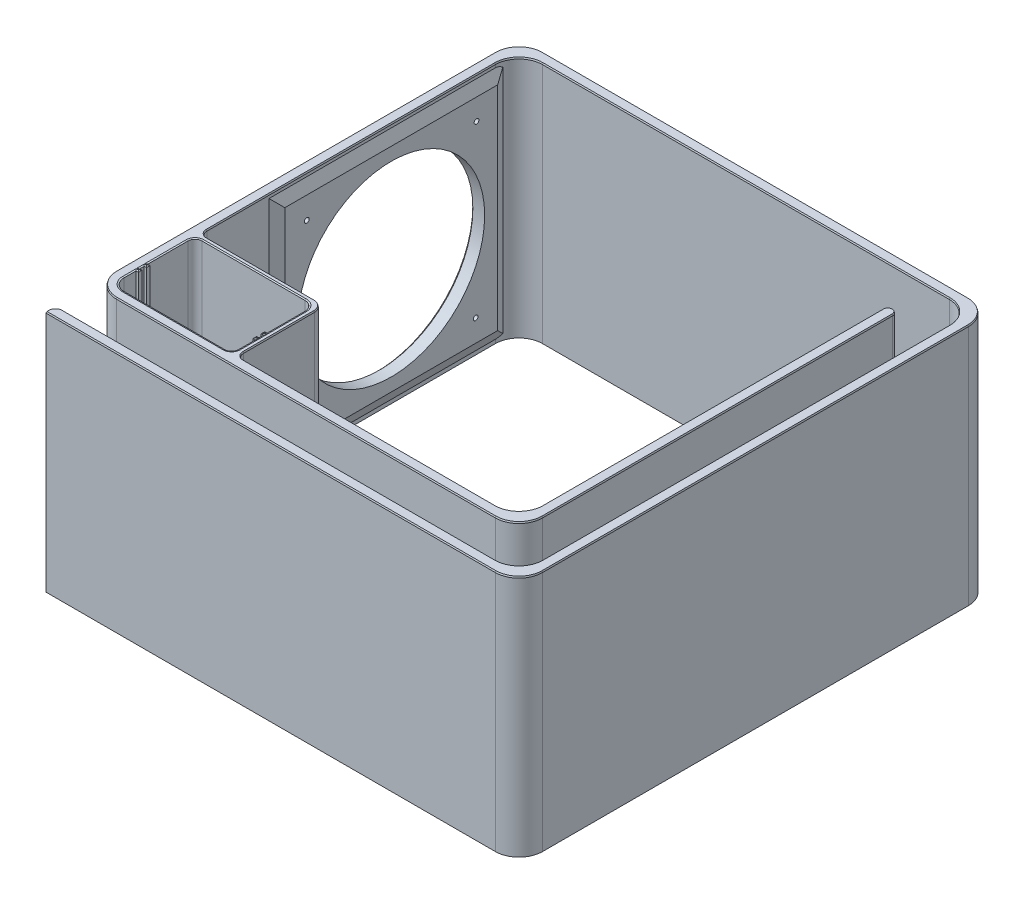
from build123d import *
from OCP.BRepFilletAPI import BRepFilletAPI_MakeChamfer

# Parameters (mm, degrees)
BOSS_EXTRUDE1_DEPTH = 103
CUT_EXTRUDE1_REACH  = 248.189
SKETCH2_R           = 39.5
SKETCH2_R_2         = 1
SKETCH3_W           = 90
SKETCH3_H           = 90
SKETCH3_R           = 39.5
BOSS_EXTRUDE2_DEPTH = 2
CUT_EXTRUDE2_REACH  = 244.951
SKETCH6_R           = 1
CHAMFER4_SIZE       = 1
CHAMFER5_SIZE       = 0.2
CHAMFER5_SIZE2      = 0.615536707
CUT_EXTRUDE3_REACH  = 248.189
FILLET1_R           = 0.4
CUT_EXTRUDE4_REACH  = 204.981


# Some blends are built 0.0001 mm under size
with BuildPart() as part:
    # Sketch1 → Boss-Extrude1 (new body)
    with BuildSketch(Plane(origin=(0, 0, 0), x_dir=(1, 0, 0), z_dir=(0, 1, 0))):
        with BuildLine():
            Line((-100, 90), (-100, -70.2))
            ThreePointArc((-100, -70.2), (-97.129646456, -77.129646456), (-90.2, -80))
            Line((-90.2, -80), (70, -80))
            ThreePointArc((70, -80), (77.071067812, -77.071067812), (80, -70))
            Line((80, -70), (80, 78))
            ThreePointArc((80, 78), (78, 80), (76, 78))
            Line((76, 78), (76, -66))
            ThreePointArc((76, -66), (73.071067812, -73.071067812), (66, -76))
            Line((66, -76), (-40.5, -76))
            ThreePointArc((-40.5, -76), (-42.621320344, -75.121320344), (-43.5, -73))
            Line((-43.5, -73), (-43.5, -43))
            ThreePointArc((-43.5, -43), (-44.671572875, -40.171572875), (-47.5, -39))
            Line((-47.5, -39), (-93, -39))
            ThreePointArc((-93, -39), (-95.121320344, -38.121320344), (-96, -36))
            Line((-96, -36), (-96, 86))
            ThreePointArc((-96, 86), (-93.071067812, 93.071067812), (-86, 96))
            Line((-86, 96), (86, 96))
            ThreePointArc((86, 96), (93.071067812, 93.071067812), (96, 86))
            Line((96, 86), (96, -86))
            ThreePointArc((96, -86), (93.071067812, -93.071067812), (86, -96))
            Line((86, -96), (-97, -96))
            ThreePointArc((-97, -96), (-99.121320344, -96.878679656), (-100, -99))
            Line((-100, -99), (-100, -100))
            Line((-100, -100), (90, -100))
            ThreePointArc((90, -100), (97.071067812, -97.071067812), (100, -90))
            Line((100, -90), (100, 90))
            ThreePointArc((100, 90), (97.071067812, 97.071067812), (90, 100))
            Line((90, 100), (-90, 100))
            ThreePointArc((-90, 100), (-97.071067812, 97.071067812), (-100, 90))
        make_face()
        with BuildLine():
            Line((-91, -76), (-48.5, -76))
            ThreePointArc((-48.5, -76), (-46.378679656, -75.121320344), (-45.5, -73))
            Line((-45.5, -73), (-45.5, -65.9))
            Line((-45.5, -65.9), (-46.5, -65.9))
            Line((-46.5, -65.9), (-46.5, -64.4))
            Line((-46.5, -64.4), (-45.5, -64.4))
            Line((-45.5, -64.4), (-45.5, -62.5))
            Line((-45.5, -62.5), (-46.5, -62.5))
            Line((-46.5, -62.5), (-46.5, -61))
            Line((-46.5, -61), (-45.5, -61))
            Line((-45.5, -61), (-45.5, -45))
            ThreePointArc((-45.5, -45), (-46.671572875, -42.171572875), (-49.5, -41))
            Line((-49.5, -41), (-93, -41))
            ThreePointArc((-93, -41), (-95.121320344, -41.878679656), (-96, -44))
            Line((-96, -44), (-96, -61))
            Line((-96, -61), (-95, -61))
            Line((-95, -61), (-95, -62.5))
            Line((-95, -62.5), (-96, -62.5))
            Line((-96, -62.5), (-96, -64.4))
            Line((-96, -64.4), (-95, -64.4))
            Line((-95, -64.4), (-95, -65.9))
            Line((-95, -65.9), (-96, -65.9))
            Line((-96, -65.9), (-96, -71))
            ThreePointArc((-96, -71), (-94.535533906, -74.535533906), (-91, -76))
        make_face(mode=Mode.SUBTRACT)
    extrude(amount=BOSS_EXTRUDE1_DEPTH)

    # Sketch2 → Cut-Extrude1 (cut, up to next)
    with BuildSketch(Plane.ZY.offset(100), mode=Mode.PRIVATE) as cut_extrude1_sk1:
        with Locations((-40, 51.5)):
            Circle(SKETCH2_R)
    cut_extrude1_tool1 = extrude(cut_extrude1_sk1.sketch, amount=-CUT_EXTRUDE1_REACH, mode=Mode.PRIVATE) & part.part
    # Sketch2 → Cut-Extrude1 (cut, up to next)
    with BuildSketch(Plane.ZY.offset(100), mode=Mode.PRIVATE) as cut_extrude1_sk2:
        with Locations((-4.29110755, 15.79110755)):
            Circle(SKETCH2_R_2)
    cut_extrude1_tool2 = extrude(cut_extrude1_sk2.sketch, amount=-CUT_EXTRUDE1_REACH, mode=Mode.PRIVATE) & part.part
    # Sketch2 → Cut-Extrude1 (cut, up to next)
    with BuildSketch(Plane.ZY.offset(100), mode=Mode.PRIVATE) as cut_extrude1_sk3:
        with Locations((-76.062445841, 87.562445841)):
            Circle(SKETCH2_R_2)
    cut_extrude1_tool3 = extrude(cut_extrude1_sk3.sketch, amount=-CUT_EXTRUDE1_REACH, mode=Mode.PRIVATE) & part.part
    # Sketch2 → Cut-Extrude1 (cut, up to next)
    with BuildSketch(Plane.ZY.offset(100), mode=Mode.PRIVATE) as cut_extrude1_sk4:
        with Locations((-4.29110755, 87.20889245)):
            Circle(SKETCH2_R_2)
    cut_extrude1_tool4 = extrude(cut_extrude1_sk4.sketch, amount=-CUT_EXTRUDE1_REACH, mode=Mode.PRIVATE) & part.part
    # Sketch2 → Cut-Extrude1 (cut, up to next)
    with BuildSketch(Plane.ZY.offset(100), mode=Mode.PRIVATE) as cut_extrude1_sk5:
        with Locations((-75.70889245, 15.79110755)):
            Circle(SKETCH2_R_2)
    cut_extrude1_tool5 = extrude(cut_extrude1_sk5.sketch, amount=-CUT_EXTRUDE1_REACH, mode=Mode.PRIVATE) & part.part
    add(cut_extrude1_tool1.solids().sort_by_distance((-100, 51.5, -40))[0], mode=Mode.SUBTRACT)
    add(cut_extrude1_tool2.solids().sort_by_distance((-100, 15.791108, -4.291108))[0], mode=Mode.SUBTRACT)
    add(cut_extrude1_tool3.solids().sort_by_distance((-100, 87.562446, -76.062446))[0], mode=Mode.SUBTRACT)
    add(cut_extrude1_tool4.solids().sort_by_distance((-100, 87.208892, -4.291108))[0], mode=Mode.SUBTRACT)
    add(cut_extrude1_tool5.solids().sort_by_distance((-100, 15.791108, -75.708892))[0], mode=Mode.SUBTRACT)

    # Sketch3 → Boss-Extrude2 (add)
    with BuildSketch(Plane(origin=(-96, 0, 0), x_dir=(0, 0, -1), z_dir=(1, 0, 0))):
        with Locations((40, 51.5)):
            Rectangle(SKETCH3_W, SKETCH3_H)
        with Locations(Location((40, 51.5, 0), (0, 0, 180))):
            Circle(SKETCH3_R, mode=Mode.SUBTRACT)
    extrude(amount=BOSS_EXTRUDE2_DEPTH)

    # Chamfer1
    # the kernel refuses this chamfer: 4.711704732, 2 mm, written as the material it adds along each edge
    with BuildSketch(Plane(origin=(-96, 6.5, 5), x_dir=(-0.015072497429862344, -0.9998864034585262, 0), z_dir=(0, 0, -1))) as chamfer1_piece_1_section:
        with BuildLine():
            Line((4.885745618, 0), (-0.204721115, -2.070789964))
            Line((-0.204721115, -2.070789964), (-0.298944505, -2.069369621))
            ThreePointArc((-0.298944505, -2.069369621), (-0.10985086, -1.035282072), (-0.09422339, 0.001420343))
            Line((-0.09422339, 0.001420343), (0.001420343, 0.09422339))
            ThreePointArc((0.001420343, 0.09422339), (2.44373818, 0.057407378), (4.887165962, 0.09422339))
            Line((4.887165962, 0.09422339), (4.885745618, 0))
        make_face()
    chamfer1_piece_1 = extrude(amount=90, mode=Mode.PRIVATE)
    chamfer1_piece_1 = split(chamfer1_piece_1, bisect_by=Plane(origin=(-94, 4.895620151, -40), z_dir=(-1, 0, 0)), keep=Keep.TOP, mode=Mode.PRIVATE)
    add(chamfer1_piece_1)
    with BuildSketch(Plane(origin=(-96, 96.5, 5), x_dir=(-0.015072497429862348, 0, 0.9998864034585262), z_dir=(0, -1, 0))) as chamfer1_piece_2_section:
        with BuildLine():
            Line((4.885745618, 0), (-0.204721115, -2.070789964))
            Line((-0.204721115, -2.070789964), (-0.298944505, -2.069369621))
            ThreePointArc((-0.298944505, -2.069369621), (-0.10985086, -1.035282072), (-0.09422339, 0.001420343))
            Line((-0.09422339, 0.001420343), (0.001420343, 0.09422339))
            ThreePointArc((0.001420343, 0.09422339), (2.44373818, 0.057407378), (4.887165962, 0.09422339))
            Line((4.887165962, 0.09422339), (4.885745618, 0))
        make_face()
    chamfer1_piece_2 = extrude(amount=90, mode=Mode.PRIVATE)
    chamfer1_piece_2 = split(chamfer1_piece_2, bisect_by=Plane(origin=(-94, 51.5, 6.604379849), z_dir=(-1, 0, 0)), keep=Keep.TOP, mode=Mode.PRIVATE)
    add(chamfer1_piece_2)
    with BuildSketch(Plane(origin=(-96, 96.5, -85), x_dir=(-0.015072497429859466, 0.9998864034585264, 0), z_dir=(0, 0, 1))) as chamfer1_piece_3_section:
        with BuildLine():
            Line((4.885745618, 0), (-0.204721115, -2.070789964))
            Line((-0.204721115, -2.070789964), (-0.298944505, -2.069369621))
            ThreePointArc((-0.298944505, -2.069369621), (-0.10985086, -1.035282072), (-0.09422339, 0.001420343))
            Line((-0.09422339, 0.001420343), (0.001420343, 0.09422339))
            ThreePointArc((0.001420343, 0.09422339), (2.44373818, 0.057407378), (4.887165962, 0.09422339))
            Line((4.887165962, 0.09422339), (4.885745618, 0))
        make_face()
    chamfer1_piece_3 = extrude(amount=90, mode=Mode.PRIVATE)
    chamfer1_piece_3 = split(chamfer1_piece_3, bisect_by=Plane(origin=(-94, 98.104379849, -40), z_dir=(-1, 0, 0)), keep=Keep.TOP, mode=Mode.PRIVATE)
    add(chamfer1_piece_3)
    with BuildSketch(Plane(origin=(-96, 6.5, -85), x_dir=(-0.015072497429859423, 0, -0.9998864034585264), z_dir=(0, 1, 0))) as chamfer1_piece_4_section:
        with BuildLine():
            Line((4.885745618, 0), (-0.204721115, -2.070789964))
            Line((-0.204721115, -2.070789964), (-0.298944505, -2.069369621))
            ThreePointArc((-0.298944505, -2.069369621), (-0.10985086, -1.035282072), (-0.09422339, 0.001420343))
            Line((-0.09422339, 0.001420343), (0.001420343, 0.09422339))
            ThreePointArc((0.001420343, 0.09422339), (2.44373818, 0.057407378), (4.887165962, 0.09422339))
            Line((4.887165962, 0.09422339), (4.885745618, 0))
        make_face()
    chamfer1_piece_4 = extrude(amount=90, mode=Mode.PRIVATE)
    chamfer1_piece_4 = split(chamfer1_piece_4, bisect_by=Plane(origin=(-94, 51.5, -86.604379849), z_dir=(-1, 0, 0)), keep=Keep.TOP, mode=Mode.PRIVATE)
    add(chamfer1_piece_4)
    with BuildSketch(Plane(origin=(-96, 96.5, 5), x_dir=(-0.015072497429862348, 0, 0.9998864034585262), z_dir=(0, -1, 0))) as chamfer1_piece_5a_section:
        with BuildLine():
            Line((4.885745618, 0), (-0.204721115, -2.070789964))
            Line((-0.204721115, -2.070789964), (-0.298944505, -2.069369621))
            ThreePointArc((-0.298944505, -2.069369621), (-0.10985086, -1.035282072), (-0.09422339, 0.001420343))
            Line((-0.09422339, 0.001420343), (0.001420343, 0.09422339))
            ThreePointArc((0.001420343, 0.09422339), (2.44373818, 0.057407378), (4.887165962, 0.09422339))
            Line((4.887165962, 0.09422339), (4.885745618, 0))
        make_face()
    chamfer1_piece_5a = extrude(amount=102.214364046, mode=Mode.PRIVATE)
    chamfer1_piece_5a = split(chamfer1_piece_5a, bisect_by=Plane(origin=(-95.378057089, 0, 6.604379849), z_dir=(0, 1, 0)), keep=Keep.TOP, mode=Mode.PRIVATE)
    chamfer1_piece_5a = split(chamfer1_piece_5a, bisect_by=Plane(origin=(-95.378057089, 6.5, 6.604379849), z_dir=(0, -1, 0)), keep=Keep.TOP, mode=Mode.PRIVATE)
    chamfer1_piece_5a = split(chamfer1_piece_5a, bisect_by=Plane(origin=(-94, 3.25, 6.604379849), z_dir=(-1, 0, 0)), keep=Keep.TOP, mode=Mode.PRIVATE)
    with BuildSketch(Plane(origin=(-96, 6.5, 17.214364046), x_dir=(-0.015072497429862344, -0.9998864034585262, 0), z_dir=(0, 0, -1))) as chamfer1_piece_5b_section:
        with BuildLine():
            Line((4.885745618, 0), (-0.204721115, -2.070789964))
            Line((-0.204721115, -2.070789964), (-0.298944505, -2.069369621))
            ThreePointArc((-0.298944505, -2.069369621), (-0.10985086, -1.035282072), (-0.09422339, 0.001420343))
            Line((-0.09422339, 0.001420343), (0.001420343, 0.09422339))
            ThreePointArc((0.001420343, 0.09422339), (2.44373818, 0.057407378), (4.887165962, 0.09422339))
            Line((4.887165962, 0.09422339), (4.885745618, 0))
        make_face()
    chamfer1_piece_5b = extrude(amount=102.214364046, mode=Mode.PRIVATE)
    chamfer1_piece_5b = split(chamfer1_piece_5b, bisect_by=Plane(origin=(-95.378057089, 4.895620151, 5), z_dir=(0, 0, 1)), keep=Keep.TOP, mode=Mode.PRIVATE)
    chamfer1_piece_5b = split(chamfer1_piece_5b, bisect_by=Plane(origin=(-94, 4.895620151, 11.107182023), z_dir=(-1, 0, 0)), keep=Keep.TOP, mode=Mode.PRIVATE)
    chamfer1_piece_5 = chamfer1_piece_5a & chamfer1_piece_5b
    add(chamfer1_piece_5)
    with BuildSketch(Plane(origin=(-96, -5.714364046, -85), x_dir=(-0.015072497429862372, 0, -0.9998864034585262), z_dir=(0, 1, 0))) as chamfer1_piece_6a_section:
        with BuildLine():
            Line((4.885745618, 0), (-0.204721115, -2.070789964))
            Line((-0.204721115, -2.070789964), (-0.298944505, -2.069369621))
            ThreePointArc((-0.298944505, -2.069369621), (-0.10985086, -1.035282072), (-0.09422339, 0.001420343))
            Line((-0.09422339, 0.001420343), (0.001420343, 0.09422339))
            ThreePointArc((0.001420343, 0.09422339), (2.44373818, 0.057407378), (4.887165962, 0.09422339))
            Line((4.887165962, 0.09422339), (4.885745618, 0))
        make_face()
    chamfer1_piece_6a = extrude(amount=102.214364046, mode=Mode.PRIVATE)
    chamfer1_piece_6a = split(chamfer1_piece_6a, bisect_by=Plane(origin=(-95.378057089, 0, -86.604379849), z_dir=(0, 1, 0)), keep=Keep.TOP, mode=Mode.PRIVATE)
    chamfer1_piece_6a = split(chamfer1_piece_6a, bisect_by=Plane(origin=(-95.378057089, 6.5, -86.604379849), z_dir=(0, -1, 0)), keep=Keep.TOP, mode=Mode.PRIVATE)
    chamfer1_piece_6a = split(chamfer1_piece_6a, bisect_by=Plane(origin=(-94, 3.25, -86.604379849), z_dir=(-1, 0, 0)), keep=Keep.TOP, mode=Mode.PRIVATE)
    with BuildSketch(Plane(origin=(-96, 6.5, 5), x_dir=(-0.015072497429862344, -0.9998864034585262, 0), z_dir=(0, 0, -1))) as chamfer1_piece_6b_section:
        with BuildLine():
            Line((4.885745618, 0), (-0.204721115, -2.070789964))
            Line((-0.204721115, -2.070789964), (-0.298944505, -2.069369621))
            ThreePointArc((-0.298944505, -2.069369621), (-0.10985086, -1.035282072), (-0.09422339, 0.001420343))
            Line((-0.09422339, 0.001420343), (0.001420343, 0.09422339))
            ThreePointArc((0.001420343, 0.09422339), (2.44373818, 0.057407378), (4.887165962, 0.09422339))
            Line((4.887165962, 0.09422339), (4.885745618, 0))
        make_face()
    chamfer1_piece_6b = extrude(amount=102.214364046, mode=Mode.PRIVATE)
    chamfer1_piece_6b = split(chamfer1_piece_6b, bisect_by=Plane(origin=(-95.378057089, 4.895620151, -85), z_dir=(0, 0, -1)), keep=Keep.TOP, mode=Mode.PRIVATE)
    chamfer1_piece_6b = split(chamfer1_piece_6b, bisect_by=Plane(origin=(-94, 4.895620151, -91.107182023), z_dir=(-1, 0, 0)), keep=Keep.TOP, mode=Mode.PRIVATE)
    chamfer1_piece_6 = chamfer1_piece_6a & chamfer1_piece_6b
    add(chamfer1_piece_6)
    with BuildSketch(Plane(origin=(-96, 108.714364046, 5), x_dir=(-0.015072497429862344, 0, 0.9998864034585262), z_dir=(0, -1, 0))) as chamfer1_piece_7a_section:
        with BuildLine():
            Line((4.885745618, 0), (-0.204721115, -2.070789964))
            Line((-0.204721115, -2.070789964), (-0.298944505, -2.069369621))
            ThreePointArc((-0.298944505, -2.069369621), (-0.10985086, -1.035282072), (-0.09422339, 0.001420343))
            Line((-0.09422339, 0.001420343), (0.001420343, 0.09422339))
            ThreePointArc((0.001420343, 0.09422339), (2.44373818, 0.057407378), (4.887165962, 0.09422339))
            Line((4.887165962, 0.09422339), (4.885745618, 0))
        make_face()
    chamfer1_piece_7a = extrude(amount=102.214364046, mode=Mode.PRIVATE)
    chamfer1_piece_7a = split(chamfer1_piece_7a, bisect_by=Plane(origin=(-95.378057089, 103, 6.604379849), z_dir=(0, -1, 0)), keep=Keep.TOP, mode=Mode.PRIVATE)
    chamfer1_piece_7a = split(chamfer1_piece_7a, bisect_by=Plane(origin=(-95.378057089, 96.5, 6.604379849), z_dir=(0, 1, 0)), keep=Keep.TOP, mode=Mode.PRIVATE)
    chamfer1_piece_7a = split(chamfer1_piece_7a, bisect_by=Plane(origin=(-94, 99.75, 6.604379849), z_dir=(-1, 0, 0)), keep=Keep.TOP, mode=Mode.PRIVATE)
    with BuildSketch(Plane(origin=(-96, 96.5, -85), x_dir=(-0.015072497429859466, 0.9998864034585264, 0), z_dir=(0, 0, 1))) as chamfer1_piece_7b_section:
        with BuildLine():
            Line((4.885745618, 0), (-0.204721115, -2.070789964))
            Line((-0.204721115, -2.070789964), (-0.298944505, -2.069369621))
            ThreePointArc((-0.298944505, -2.069369621), (-0.10985086, -1.035282072), (-0.09422339, 0.001420343))
            Line((-0.09422339, 0.001420343), (0.001420343, 0.09422339))
            ThreePointArc((0.001420343, 0.09422339), (2.44373818, 0.057407378), (4.887165962, 0.09422339))
            Line((4.887165962, 0.09422339), (4.885745618, 0))
        make_face()
    chamfer1_piece_7b = extrude(amount=102.214364046, mode=Mode.PRIVATE)
    chamfer1_piece_7b = split(chamfer1_piece_7b, bisect_by=Plane(origin=(-95.378057089, 98.104379849, 5), z_dir=(0, 0, 1)), keep=Keep.TOP, mode=Mode.PRIVATE)
    chamfer1_piece_7b = split(chamfer1_piece_7b, bisect_by=Plane(origin=(-94, 98.104379849, 11.107182023), z_dir=(-1, 0, 0)), keep=Keep.TOP, mode=Mode.PRIVATE)
    chamfer1_piece_7 = chamfer1_piece_7a & chamfer1_piece_7b
    add(chamfer1_piece_7)
    with BuildSketch(Plane(origin=(-96, 96.5, -97.214364046), x_dir=(-0.015072497429862372, 0.9998864034585262, 0), z_dir=(0, 0, 1))) as chamfer1_piece_8a_section:
        with BuildLine():
            Line((4.885745618, 0), (-0.204721115, -2.070789964))
            Line((-0.204721115, -2.070789964), (-0.298944505, -2.069369621))
            ThreePointArc((-0.298944505, -2.069369621), (-0.10985086, -1.035282072), (-0.09422339, 0.001420343))
            Line((-0.09422339, 0.001420343), (0.001420343, 0.09422339))
            ThreePointArc((0.001420343, 0.09422339), (2.44373818, 0.057407378), (4.887165962, 0.09422339))
            Line((4.887165962, 0.09422339), (4.885745618, 0))
        make_face()
    chamfer1_piece_8a = extrude(amount=102.214364046, mode=Mode.PRIVATE)
    chamfer1_piece_8a = split(chamfer1_piece_8a, bisect_by=Plane(origin=(-95.378057089, 98.104379849, -85), z_dir=(0, 0, -1)), keep=Keep.TOP, mode=Mode.PRIVATE)
    chamfer1_piece_8a = split(chamfer1_piece_8a, bisect_by=Plane(origin=(-94, 98.104379849, -91.107182023), z_dir=(-1, 0, 0)), keep=Keep.TOP, mode=Mode.PRIVATE)
    with BuildSketch(Plane(origin=(-96, 6.5, -85), x_dir=(-0.015072497429859423, 0, -0.9998864034585264), z_dir=(0, 1, 0))) as chamfer1_piece_8b_section:
        with BuildLine():
            Line((4.885745618, 0), (-0.204721115, -2.070789964))
            Line((-0.204721115, -2.070789964), (-0.298944505, -2.069369621))
            ThreePointArc((-0.298944505, -2.069369621), (-0.10985086, -1.035282072), (-0.09422339, 0.001420343))
            Line((-0.09422339, 0.001420343), (0.001420343, 0.09422339))
            ThreePointArc((0.001420343, 0.09422339), (2.44373818, 0.057407378), (4.887165962, 0.09422339))
            Line((4.887165962, 0.09422339), (4.885745618, 0))
        make_face()
    chamfer1_piece_8b = extrude(amount=102.214364046, mode=Mode.PRIVATE)
    chamfer1_piece_8b = split(chamfer1_piece_8b, bisect_by=Plane(origin=(-95.378057089, 103, -86.604379849), z_dir=(0, -1, 0)), keep=Keep.TOP, mode=Mode.PRIVATE)
    chamfer1_piece_8b = split(chamfer1_piece_8b, bisect_by=Plane(origin=(-95.378057089, 96.5, -86.604379849), z_dir=(0, 1, 0)), keep=Keep.TOP, mode=Mode.PRIVATE)
    chamfer1_piece_8b = split(chamfer1_piece_8b, bisect_by=Plane(origin=(-94, 99.75, -86.604379849), z_dir=(-1, 0, 0)), keep=Keep.TOP, mode=Mode.PRIVATE)
    chamfer1_piece_8 = chamfer1_piece_8a & chamfer1_piece_8b
    add(chamfer1_piece_8)

    # Sketch6 → Cut-Extrude2 (cut, up to next)
    with BuildSketch(Plane.ZY.offset(96), mode=Mode.PRIVATE) as cut_extrude2_sk1:
        with Locations((-75.70889245, 15.79110755)):
            Circle(SKETCH6_R)
    cut_extrude2_tool1 = extrude(cut_extrude2_sk1.sketch, amount=-CUT_EXTRUDE2_REACH, mode=Mode.PRIVATE) & part.part
    # Sketch6 → Cut-Extrude2 (cut, up to next)
    with BuildSketch(Plane.ZY.offset(96), mode=Mode.PRIVATE) as cut_extrude2_sk2:
        with Locations((-4.29110755, 15.79110755)):
            Circle(SKETCH6_R)
    cut_extrude2_tool2 = extrude(cut_extrude2_sk2.sketch, amount=-CUT_EXTRUDE2_REACH, mode=Mode.PRIVATE) & part.part
    # Sketch6 → Cut-Extrude2 (cut, up to next)
    with BuildSketch(Plane.ZY.offset(96), mode=Mode.PRIVATE) as cut_extrude2_sk3:
        with Locations((-76.062445841, 87.562445841)):
            Circle(SKETCH6_R)
    cut_extrude2_tool3 = extrude(cut_extrude2_sk3.sketch, amount=-CUT_EXTRUDE2_REACH, mode=Mode.PRIVATE) & part.part
    # Sketch6 → Cut-Extrude2 (cut, up to next)
    with BuildSketch(Plane.ZY.offset(96), mode=Mode.PRIVATE) as cut_extrude2_sk4:
        with Locations((-4.29110755, 87.20889245)):
            Circle(SKETCH6_R)
    cut_extrude2_tool4 = extrude(cut_extrude2_sk4.sketch, amount=-CUT_EXTRUDE2_REACH, mode=Mode.PRIVATE) & part.part
    add(cut_extrude2_tool1.solids().sort_by_distance((-96, 15.791108, -75.708892))[0], mode=Mode.SUBTRACT)
    add(cut_extrude2_tool2.solids().sort_by_distance((-96, 15.791108, -4.291108))[0], mode=Mode.SUBTRACT)
    add(cut_extrude2_tool3.solids().sort_by_distance((-96, 87.562446, -76.062446))[0], mode=Mode.SUBTRACT)
    add(cut_extrude2_tool4.solids().sort_by_distance((-96, 87.208892, -4.291108))[0], mode=Mode.SUBTRACT)

    # Chamfer4
    chamfer4_edges = [part.edges().sort_by_distance(p)[0] for p in [
        (-100, 51.5, -79.5),
    ]]
    chamfer(chamfer4_edges, length=CHAMFER4_SIZE)

    # Chamfer5: one chamfer whose edges measure the first distance from different faces: ONE call of the kernel's chamfer builder (chamfer() names one face for all edges)
    chamfer5_edges_1 = [part.edges().sort_by_distance(p)[0] for p in [
        (-46, 103, 64.4),
    ]]
    chamfer5_side_1 = [part.faces().sort_by_distance(p)[0] for p in [
        (-46, 51.5, 64.4),
    ]]
    chamfer5_edges_2 = [part.edges().sort_by_distance(p)[0] for p in [
        (-45.5, 103, 63.45),
    ]]
    chamfer5_side_2 = [part.faces().sort_by_distance(p)[0] for p in [
        (-45.5, 51.5, 63.45),
    ]]
    chamfer5_edges_3 = [part.edges().sort_by_distance(p)[0] for p in [
        (-46, 103, 62.5),
    ]]
    chamfer5_side_3 = [part.faces().sort_by_distance(p)[0] for p in [
        (-46, 51.5, 62.5),
    ]]
    chamfer5_edges_4 = [part.edges().sort_by_distance(p)[0] for p in [
        (-100, 103, -9.9),
        (-97.129646456, 103, 77.129646456),
        (-10.1, 103, 80),
        (77.071067812, 103, 77.071067812),
        (80, 103, -4),
        (73.071067812, 103, 73.071067812),
        (12.75, 103, 76),
        (-42.621320344, 103, 75.121320344),
        (-43.5, 103, 58),
        (-44.671572875, 103, 40.171572875),
        (-70.25, 103, 39),
        (-95.121320344, 103, 38.121320344),
        (-96, 103, -25),
        (-93.071067812, 103, -93.071067812),
        (0, 103, -96),
        (78, 103, -80),
        (93.071067812, 103, -93.071067812),
        (96, 103, 0),
        (93.071067812, 103, 93.071067812),
        (-5.5, 103, 96),
        (-99.121320344, 103, 96.878679656),
        (-100, 103, 99.5),
        (-5, 103, 100),
        (97.071067812, 103, 97.071067812),
        (100, 103, 0),
        (97.071067812, 103, -97.071067812),
        (76, 103, -6),
        (0, 103, -100),
        (-97.071067812, 103, -97.071067812),
    ]]
    chamfer5_side_4 = [part.faces().sort_by_distance(p)[0] for p in [
        (95.071067812, 103, 95.071067812),
    ]]
    chamfer5_edges_5 = [part.edges().sort_by_distance(p)[0] for p in [
        (-46.5, 103, 61.75),
    ]]
    chamfer5_side_5 = [part.faces().sort_by_distance(p)[0] for p in [
        (-46.5, 51.5, 61.75),
    ]]
    chamfer5_edges_6 = [part.edges().sort_by_distance(p)[0] for p in [
        (-46, 103, 61),
    ]]
    chamfer5_side_6 = [part.faces().sort_by_distance(p)[0] for p in [
        (-46, 51.5, 61),
    ]]
    chamfer5_edges_7 = [part.edges().sort_by_distance(p)[0] for p in [
        (-45.5, 103, 53),
    ]]
    chamfer5_side_7 = [part.faces().sort_by_distance(p)[0] for p in [
        (-45.5, 51.5, 53),
    ]]
    chamfer5_edges_8 = [part.edges().sort_by_distance(p)[0] for p in [
        (-46.671572875, 103, 42.171572875),
    ]]
    chamfer5_side_8 = [part.faces().sort_by_distance(p)[0] for p in [
        (-46.671572875, 51.5, 42.171572875),
    ]]
    chamfer5_edges_9 = [part.edges().sort_by_distance(p)[0] for p in [
        (-71.25, 103, 41),
    ]]
    chamfer5_side_9 = [part.faces().sort_by_distance(p)[0] for p in [
        (-71.25, 51.5, 41),
    ]]
    chamfer5_edges_10 = [part.edges().sort_by_distance(p)[0] for p in [
        (-95.121320344, 103, 41.878679656),
    ]]
    chamfer5_side_10 = [part.faces().sort_by_distance(p)[0] for p in [
        (-95.121320344, 51.5, 41.878679656),
    ]]
    chamfer5_edges_11 = [part.edges().sort_by_distance(p)[0] for p in [
        (-96, 103, 52.5),
    ]]
    chamfer5_side_11 = [part.faces().sort_by_distance(p)[0] for p in [
        (-96, 51.5, 52.5),
    ]]
    chamfer5_edges_12 = [part.edges().sort_by_distance(p)[0] for p in [
        (-95.5, 103, 61),
    ]]
    chamfer5_side_12 = [part.faces().sort_by_distance(p)[0] for p in [
        (-95.5, 51.5, 61),
    ]]
    chamfer5_edges_13 = [part.edges().sort_by_distance(p)[0] for p in [
        (-95, 103, 61.75),
    ]]
    chamfer5_side_13 = [part.faces().sort_by_distance(p)[0] for p in [
        (-95, 51.5, 61.75),
    ]]
    chamfer5_edges_14 = [part.edges().sort_by_distance(p)[0] for p in [
        (-95.5, 103, 62.5),
    ]]
    chamfer5_side_14 = [part.faces().sort_by_distance(p)[0] for p in [
        (-95.5, 51.5, 62.5),
    ]]
    chamfer5_edges_15 = [part.edges().sort_by_distance(p)[0] for p in [
        (-96, 103, 63.45),
    ]]
    chamfer5_side_15 = [part.faces().sort_by_distance(p)[0] for p in [
        (-96, 51.5, 63.45),
    ]]
    chamfer5_edges_16 = [part.edges().sort_by_distance(p)[0] for p in [
        (-95.5, 103, 64.4),
    ]]
    chamfer5_side_16 = [part.faces().sort_by_distance(p)[0] for p in [
        (-95.5, 51.5, 64.4),
    ]]
    chamfer5_edges_17 = [part.edges().sort_by_distance(p)[0] for p in [
        (-95, 103, 65.15),
    ]]
    chamfer5_side_17 = [part.faces().sort_by_distance(p)[0] for p in [
        (-95, 51.5, 65.15),
    ]]
    chamfer5_edges_18 = [part.edges().sort_by_distance(p)[0] for p in [
        (-95.5, 103, 65.9),
    ]]
    chamfer5_side_18 = [part.faces().sort_by_distance(p)[0] for p in [
        (-95.5, 51.5, 65.9),
    ]]
    chamfer5_edges_19 = [part.edges().sort_by_distance(p)[0] for p in [
        (-96, 103, 68.45),
    ]]
    chamfer5_side_19 = [part.faces().sort_by_distance(p)[0] for p in [
        (-96, 51.5, 68.45),
    ]]
    chamfer5_edges_20 = [part.edges().sort_by_distance(p)[0] for p in [
        (80, 0, -4),
    ]]
    chamfer5_side_20 = [part.faces().sort_by_distance(p)[0] for p in [
        (80, 51.5, -4),
    ]]
    chamfer5_edges_21 = [part.edges().sort_by_distance(p)[0] for p in [
        (77.071067812, 0, 77.071067812),
    ]]
    chamfer5_side_21 = [part.faces().sort_by_distance(p)[0] for p in [
        (77.071067812, 51.5, 77.071067812),
    ]]
    chamfer5_edges_22 = [part.edges().sort_by_distance(p)[0] for p in [
        (-10.1, 0, 80),
    ]]
    chamfer5_side_22 = [part.faces().sort_by_distance(p)[0] for p in [
        (-10.1, 51.5, 80),
    ]]
    chamfer5_edges_23 = [part.edges().sort_by_distance(p)[0] for p in [
        (-97.129646456, 0, 77.129646456),
    ]]
    chamfer5_side_23 = [part.faces().sort_by_distance(p)[0] for p in [
        (-97.129646456, 51.5, 77.129646456),
    ]]
    chamfer5_edges_24 = [part.edges().sort_by_distance(p)[0] for p in [
        (-100, 0, -9.9),
    ]]
    chamfer5_side_24 = [part.faces().sort_by_distance(p)[0] for p in [
        (-100, 51.49990201, 3.817166393),
    ]]
    chamfer5_edges_25 = [part.edges().sort_by_distance(p)[0] for p in [
        (-97.071067812, 0, -97.071067812),
    ]]
    chamfer5_side_25 = [part.faces().sort_by_distance(p)[0] for p in [
        (-97.071067812, 51.5, -97.071067812),
    ]]
    chamfer5_edges_26 = [part.edges().sort_by_distance(p)[0] for p in [
        (0, 0, -100),
    ]]
    chamfer5_side_26 = [part.faces().sort_by_distance(p)[0] for p in [
        (0, 51.5, -100),
    ]]
    chamfer5_edges_27 = [part.edges().sort_by_distance(p)[0] for p in [
        (97.071067812, 0, -97.071067812),
    ]]
    chamfer5_side_27 = [part.faces().sort_by_distance(p)[0] for p in [
        (97.071067812, 51.5, -97.071067812),
    ]]
    chamfer5_edges_28 = [part.edges().sort_by_distance(p)[0] for p in [
        (100, 0, 0),
    ]]
    chamfer5_side_28 = [part.faces().sort_by_distance(p)[0] for p in [
        (100, 51.5, 0),
    ]]
    chamfer5_edges_29 = [part.edges().sort_by_distance(p)[0] for p in [
        (97.071067812, 0, 97.071067812),
    ]]
    chamfer5_side_29 = [part.faces().sort_by_distance(p)[0] for p in [
        (97.071067812, 51.5, 97.071067812),
    ]]
    chamfer5_edges_30 = [part.edges().sort_by_distance(p)[0] for p in [
        (-5, 0, 100),
    ]]
    chamfer5_side_30 = [part.faces().sort_by_distance(p)[0] for p in [
        (-5, 51.5, 100),
    ]]
    chamfer5_edges_31 = [part.edges().sort_by_distance(p)[0] for p in [
        (-100, 0, 99.5),
    ]]
    chamfer5_side_31 = [part.faces().sort_by_distance(p)[0] for p in [
        (-100, 51.5, 99.5),
    ]]
    chamfer5_edges_32 = [part.edges().sort_by_distance(p)[0] for p in [
        (-99.121320344, 0, 96.878679656),
    ]]
    chamfer5_side_32 = [part.faces().sort_by_distance(p)[0] for p in [
        (-99.121320344, 51.5, 96.878679656),
    ]]
    chamfer5_edges_33 = [part.edges().sort_by_distance(p)[0] for p in [
        (-5.5, 0, 96),
    ]]
    chamfer5_side_33 = [part.faces().sort_by_distance(p)[0] for p in [
        (-5.5, 51.5, 96),
    ]]
    chamfer5_edges_34 = [part.edges().sort_by_distance(p)[0] for p in [
        (93.071067812, 0, 93.071067812),
    ]]
    chamfer5_side_34 = [part.faces().sort_by_distance(p)[0] for p in [
        (93.071067812, 51.5, 93.071067812),
    ]]
    chamfer5_edges_35 = [part.edges().sort_by_distance(p)[0] for p in [
        (96, 0, 0),
    ]]
    chamfer5_side_35 = [part.faces().sort_by_distance(p)[0] for p in [
        (96, 51.5, 0),
    ]]
    chamfer5_edges_36 = [part.edges().sort_by_distance(p)[0] for p in [
        (93.071067812, 0, -93.071067812),
    ]]
    chamfer5_side_36 = [part.faces().sort_by_distance(p)[0] for p in [
        (93.071067812, 51.5, -93.071067812),
    ]]
    chamfer5_edges_37 = [part.edges().sort_by_distance(p)[0] for p in [
        (0, 0, -96),
    ]]
    chamfer5_side_37 = [part.faces().sort_by_distance(p)[0] for p in [
        (0, 51.5, -96),
    ]]
    chamfer5_edges_38 = [part.edges().sort_by_distance(p)[0] for p in [
        (-93.071067812, 0, -93.071067812),
    ]]
    chamfer5_side_38 = [part.faces().sort_by_distance(p)[0] for p in [
        (-93.071067812, 51.5, -93.071067812),
    ]]
    chamfer5_edges_39 = [part.edges().sort_by_distance(p)[0] for p in [
        (-96, 0, -25),
    ]]
    chamfer5_side_39 = [part.faces().sort_by_distance(p)[0] for p in [
        (-96, 51.5, 16.009456711),
    ]]
    chamfer5_edges_40 = [part.edges().sort_by_distance(p)[0] for p in [
        (-95.121320344, 0, 38.121320344),
    ]]
    chamfer5_side_40 = [part.faces().sort_by_distance(p)[0] for p in [
        (-95.121320344, 51.5, 38.121320344),
    ]]
    chamfer5_edges_41 = [part.edges().sort_by_distance(p)[0] for p in [
        (-70.25, 0, 39),
    ]]
    chamfer5_side_41 = [part.faces().sort_by_distance(p)[0] for p in [
        (-70.25, 51.5, 39),
    ]]
    chamfer5_edges_42 = [part.edges().sort_by_distance(p)[0] for p in [
        (-44.671572875, 0, 40.171572875),
    ]]
    chamfer5_side_42 = [part.faces().sort_by_distance(p)[0] for p in [
        (-44.671572875, 51.5, 40.171572875),
    ]]
    chamfer5_edges_43 = [part.edges().sort_by_distance(p)[0] for p in [
        (-43.5, 0, 58),
    ]]
    chamfer5_side_43 = [part.faces().sort_by_distance(p)[0] for p in [
        (-43.5, 51.5, 58),
    ]]
    chamfer5_edges_44 = [part.edges().sort_by_distance(p)[0] for p in [
        (-42.621320344, 0, 75.121320344),
    ]]
    chamfer5_side_44 = [part.faces().sort_by_distance(p)[0] for p in [
        (-42.621320344, 51.5, 75.121320344),
    ]]
    chamfer5_edges_45 = [part.edges().sort_by_distance(p)[0] for p in [
        (12.75, 0, 76),
    ]]
    chamfer5_side_45 = [part.faces().sort_by_distance(p)[0] for p in [
        (12.75, 51.5, 76),
    ]]
    chamfer5_edges_46 = [part.edges().sort_by_distance(p)[0] for p in [
        (73.071067812, 0, 73.071067812),
    ]]
    chamfer5_side_46 = [part.faces().sort_by_distance(p)[0] for p in [
        (73.071067812, 51.5, 73.071067812),
    ]]
    chamfer5_edges_47 = [part.edges().sort_by_distance(p)[0] for p in [
        (76, 0, -6),
    ]]
    chamfer5_side_47 = [part.faces().sort_by_distance(p)[0] for p in [
        (76, 51.5, -6),
    ]]
    chamfer5_edges_48 = [part.edges().sort_by_distance(p)[0] for p in [
        (78, 0, -80),
    ]]
    chamfer5_side_48 = [part.faces().sort_by_distance(p)[0] for p in [
        (78, 51.5, -80),
    ]]
    chamfer5_edges_49 = [part.edges().sort_by_distance(p)[0] for p in [
        (-94.535533906, 0, 74.535533906),
        (-69.75, 0, 76),
        (-46.378679656, 0, 75.121320344),
        (-45.5, 0, 69.45),
        (-46, 0, 65.9),
        (-46.5, 0, 65.15),
        (-46, 0, 64.4),
        (-45.5, 0, 63.45),
        (-46, 0, 62.5),
        (-46.5, 0, 61.75),
        (-46, 0, 61),
        (-45.5, 0, 53),
        (-46.671572875, 0, 42.171572875),
        (-71.25, 0, 41),
        (-95.121320344, 0, 41.878679656),
        (-96, 0, 52.5),
        (-95.5, 0, 61),
        (-95, 0, 61.75),
        (-95.5, 0, 62.5),
        (-96, 0, 63.45),
        (-95.5, 0, 64.4),
        (-95, 0, 65.15),
        (-95.5, 0, 65.9),
        (-96, 0, 68.45),
    ]]
    chamfer5_side_49 = [part.faces().sort_by_distance(p)[0] for p in [
        (95.071067812, 0, 95.071067812),
    ]]
    chamfer5_edges_50 = [part.edges().sort_by_distance(p)[0] for p in [
        (-94.535533906, 103, 74.535533906),
    ]]
    chamfer5_side_50 = [part.faces().sort_by_distance(p)[0] for p in [
        (-94.535533906, 51.5, 74.535533906),
    ]]
    chamfer5_edges_51 = [part.edges().sort_by_distance(p)[0] for p in [
        (-69.75, 103, 76),
    ]]
    chamfer5_side_51 = [part.faces().sort_by_distance(p)[0] for p in [
        (-69.75, 51.5, 76),
    ]]
    chamfer5_edges_52 = [part.edges().sort_by_distance(p)[0] for p in [
        (-46.378679656, 103, 75.121320344),
    ]]
    chamfer5_side_52 = [part.faces().sort_by_distance(p)[0] for p in [
        (-46.378679656, 51.5, 75.121320344),
    ]]
    chamfer5_edges_53 = [part.edges().sort_by_distance(p)[0] for p in [
        (-45.5, 103, 69.45),
    ]]
    chamfer5_side_53 = [part.faces().sort_by_distance(p)[0] for p in [
        (-45.5, 51.5, 69.45),
    ]]
    chamfer5_edges_54 = [part.edges().sort_by_distance(p)[0] for p in [
        (-46, 103, 65.9),
    ]]
    chamfer5_side_54 = [part.faces().sort_by_distance(p)[0] for p in [
        (-46, 51.5, 65.9),
    ]]
    chamfer5_edges_55 = [part.edges().sort_by_distance(p)[0] for p in [
        (-46.5, 103, 65.15),
    ]]
    chamfer5_side_55 = [part.faces().sort_by_distance(p)[0] for p in [
        (-46.5, 51.5, 65.15),
    ]]
    chamfer5 = BRepFilletAPI_MakeChamfer(part.part.solid().wrapped)
    for e in chamfer5_edges_1:
        chamfer5.Add(CHAMFER5_SIZE, CHAMFER5_SIZE2, e.wrapped, chamfer5_side_1[0].wrapped)  # the first distance lies on this face
    for e in chamfer5_edges_2:
        chamfer5.Add(CHAMFER5_SIZE, CHAMFER5_SIZE2, e.wrapped, chamfer5_side_2[0].wrapped)  # the first distance lies on this face
    for e in chamfer5_edges_3:
        chamfer5.Add(CHAMFER5_SIZE, CHAMFER5_SIZE2, e.wrapped, chamfer5_side_3[0].wrapped)  # the first distance lies on this face
    for e in chamfer5_edges_4:
        chamfer5.Add(CHAMFER5_SIZE, CHAMFER5_SIZE2, e.wrapped, chamfer5_side_4[0].wrapped)  # the first distance lies on this face
    for e in chamfer5_edges_5:
        chamfer5.Add(CHAMFER5_SIZE, CHAMFER5_SIZE2, e.wrapped, chamfer5_side_5[0].wrapped)  # the first distance lies on this face
    for e in chamfer5_edges_6:
        chamfer5.Add(CHAMFER5_SIZE, CHAMFER5_SIZE2, e.wrapped, chamfer5_side_6[0].wrapped)  # the first distance lies on this face
    for e in chamfer5_edges_7:
        chamfer5.Add(CHAMFER5_SIZE, CHAMFER5_SIZE2, e.wrapped, chamfer5_side_7[0].wrapped)  # the first distance lies on this face
    for e in chamfer5_edges_8:
        chamfer5.Add(CHAMFER5_SIZE, CHAMFER5_SIZE2, e.wrapped, chamfer5_side_8[0].wrapped)  # the first distance lies on this face
    for e in chamfer5_edges_9:
        chamfer5.Add(CHAMFER5_SIZE, CHAMFER5_SIZE2, e.wrapped, chamfer5_side_9[0].wrapped)  # the first distance lies on this face
    for e in chamfer5_edges_10:
        chamfer5.Add(CHAMFER5_SIZE, CHAMFER5_SIZE2, e.wrapped, chamfer5_side_10[0].wrapped)  # the first distance lies on this face
    for e in chamfer5_edges_11:
        chamfer5.Add(CHAMFER5_SIZE, CHAMFER5_SIZE2, e.wrapped, chamfer5_side_11[0].wrapped)  # the first distance lies on this face
    for e in chamfer5_edges_12:
        chamfer5.Add(CHAMFER5_SIZE, CHAMFER5_SIZE2, e.wrapped, chamfer5_side_12[0].wrapped)  # the first distance lies on this face
    for e in chamfer5_edges_13:
        chamfer5.Add(CHAMFER5_SIZE, CHAMFER5_SIZE2, e.wrapped, chamfer5_side_13[0].wrapped)  # the first distance lies on this face
    for e in chamfer5_edges_14:
        chamfer5.Add(CHAMFER5_SIZE, CHAMFER5_SIZE2, e.wrapped, chamfer5_side_14[0].wrapped)  # the first distance lies on this face
    for e in chamfer5_edges_15:
        chamfer5.Add(CHAMFER5_SIZE, CHAMFER5_SIZE2, e.wrapped, chamfer5_side_15[0].wrapped)  # the first distance lies on this face
    for e in chamfer5_edges_16:
        chamfer5.Add(CHAMFER5_SIZE, CHAMFER5_SIZE2, e.wrapped, chamfer5_side_16[0].wrapped)  # the first distance lies on this face
    for e in chamfer5_edges_17:
        chamfer5.Add(CHAMFER5_SIZE, CHAMFER5_SIZE2, e.wrapped, chamfer5_side_17[0].wrapped)  # the first distance lies on this face
    for e in chamfer5_edges_18:
        chamfer5.Add(CHAMFER5_SIZE, CHAMFER5_SIZE2, e.wrapped, chamfer5_side_18[0].wrapped)  # the first distance lies on this face
    for e in chamfer5_edges_19:
        chamfer5.Add(CHAMFER5_SIZE, CHAMFER5_SIZE2, e.wrapped, chamfer5_side_19[0].wrapped)  # the first distance lies on this face
    for e in chamfer5_edges_20:
        chamfer5.Add(CHAMFER5_SIZE, CHAMFER5_SIZE2, e.wrapped, chamfer5_side_20[0].wrapped)  # the first distance lies on this face
    for e in chamfer5_edges_21:
        chamfer5.Add(CHAMFER5_SIZE, CHAMFER5_SIZE2, e.wrapped, chamfer5_side_21[0].wrapped)  # the first distance lies on this face
    for e in chamfer5_edges_22:
        chamfer5.Add(CHAMFER5_SIZE, CHAMFER5_SIZE2, e.wrapped, chamfer5_side_22[0].wrapped)  # the first distance lies on this face
    for e in chamfer5_edges_23:
        chamfer5.Add(CHAMFER5_SIZE, CHAMFER5_SIZE2, e.wrapped, chamfer5_side_23[0].wrapped)  # the first distance lies on this face
    for e in chamfer5_edges_24:
        chamfer5.Add(CHAMFER5_SIZE, CHAMFER5_SIZE2, e.wrapped, chamfer5_side_24[0].wrapped)  # the first distance lies on this face
    for e in chamfer5_edges_25:
        chamfer5.Add(CHAMFER5_SIZE, CHAMFER5_SIZE2, e.wrapped, chamfer5_side_25[0].wrapped)  # the first distance lies on this face
    for e in chamfer5_edges_26:
        chamfer5.Add(CHAMFER5_SIZE, CHAMFER5_SIZE2, e.wrapped, chamfer5_side_26[0].wrapped)  # the first distance lies on this face
    for e in chamfer5_edges_27:
        chamfer5.Add(CHAMFER5_SIZE, CHAMFER5_SIZE2, e.wrapped, chamfer5_side_27[0].wrapped)  # the first distance lies on this face
    for e in chamfer5_edges_28:
        chamfer5.Add(CHAMFER5_SIZE, CHAMFER5_SIZE2, e.wrapped, chamfer5_side_28[0].wrapped)  # the first distance lies on this face
    for e in chamfer5_edges_29:
        chamfer5.Add(CHAMFER5_SIZE, CHAMFER5_SIZE2, e.wrapped, chamfer5_side_29[0].wrapped)  # the first distance lies on this face
    for e in chamfer5_edges_30:
        chamfer5.Add(CHAMFER5_SIZE, CHAMFER5_SIZE2, e.wrapped, chamfer5_side_30[0].wrapped)  # the first distance lies on this face
    for e in chamfer5_edges_31:
        chamfer5.Add(CHAMFER5_SIZE, CHAMFER5_SIZE2, e.wrapped, chamfer5_side_31[0].wrapped)  # the first distance lies on this face
    for e in chamfer5_edges_32:
        chamfer5.Add(CHAMFER5_SIZE, CHAMFER5_SIZE2, e.wrapped, chamfer5_side_32[0].wrapped)  # the first distance lies on this face
    for e in chamfer5_edges_33:
        chamfer5.Add(CHAMFER5_SIZE, CHAMFER5_SIZE2, e.wrapped, chamfer5_side_33[0].wrapped)  # the first distance lies on this face
    for e in chamfer5_edges_34:
        chamfer5.Add(CHAMFER5_SIZE, CHAMFER5_SIZE2, e.wrapped, chamfer5_side_34[0].wrapped)  # the first distance lies on this face
    for e in chamfer5_edges_35:
        chamfer5.Add(CHAMFER5_SIZE, CHAMFER5_SIZE2, e.wrapped, chamfer5_side_35[0].wrapped)  # the first distance lies on this face
    for e in chamfer5_edges_36:
        chamfer5.Add(CHAMFER5_SIZE, CHAMFER5_SIZE2, e.wrapped, chamfer5_side_36[0].wrapped)  # the first distance lies on this face
    for e in chamfer5_edges_37:
        chamfer5.Add(CHAMFER5_SIZE, CHAMFER5_SIZE2, e.wrapped, chamfer5_side_37[0].wrapped)  # the first distance lies on this face
    for e in chamfer5_edges_38:
        chamfer5.Add(CHAMFER5_SIZE, CHAMFER5_SIZE2, e.wrapped, chamfer5_side_38[0].wrapped)  # the first distance lies on this face
    for e in chamfer5_edges_39:
        chamfer5.Add(CHAMFER5_SIZE, CHAMFER5_SIZE2, e.wrapped, chamfer5_side_39[0].wrapped)  # the first distance lies on this face
    for e in chamfer5_edges_40:
        chamfer5.Add(CHAMFER5_SIZE, CHAMFER5_SIZE2, e.wrapped, chamfer5_side_40[0].wrapped)  # the first distance lies on this face
    for e in chamfer5_edges_41:
        chamfer5.Add(CHAMFER5_SIZE, CHAMFER5_SIZE2, e.wrapped, chamfer5_side_41[0].wrapped)  # the first distance lies on this face
    for e in chamfer5_edges_42:
        chamfer5.Add(CHAMFER5_SIZE, CHAMFER5_SIZE2, e.wrapped, chamfer5_side_42[0].wrapped)  # the first distance lies on this face
    for e in chamfer5_edges_43:
        chamfer5.Add(CHAMFER5_SIZE, CHAMFER5_SIZE2, e.wrapped, chamfer5_side_43[0].wrapped)  # the first distance lies on this face
    for e in chamfer5_edges_44:
        chamfer5.Add(CHAMFER5_SIZE, CHAMFER5_SIZE2, e.wrapped, chamfer5_side_44[0].wrapped)  # the first distance lies on this face
    for e in chamfer5_edges_45:
        chamfer5.Add(CHAMFER5_SIZE, CHAMFER5_SIZE2, e.wrapped, chamfer5_side_45[0].wrapped)  # the first distance lies on this face
    for e in chamfer5_edges_46:
        chamfer5.Add(CHAMFER5_SIZE, CHAMFER5_SIZE2, e.wrapped, chamfer5_side_46[0].wrapped)  # the first distance lies on this face
    for e in chamfer5_edges_47:
        chamfer5.Add(CHAMFER5_SIZE, CHAMFER5_SIZE2, e.wrapped, chamfer5_side_47[0].wrapped)  # the first distance lies on this face
    for e in chamfer5_edges_48:
        chamfer5.Add(CHAMFER5_SIZE, CHAMFER5_SIZE2, e.wrapped, chamfer5_side_48[0].wrapped)  # the first distance lies on this face
    for e in chamfer5_edges_49:
        chamfer5.Add(CHAMFER5_SIZE, CHAMFER5_SIZE2, e.wrapped, chamfer5_side_49[0].wrapped)  # the first distance lies on this face
    for e in chamfer5_edges_50:
        chamfer5.Add(CHAMFER5_SIZE, CHAMFER5_SIZE2, e.wrapped, chamfer5_side_50[0].wrapped)  # the first distance lies on this face
    for e in chamfer5_edges_51:
        chamfer5.Add(CHAMFER5_SIZE, CHAMFER5_SIZE2, e.wrapped, chamfer5_side_51[0].wrapped)  # the first distance lies on this face
    for e in chamfer5_edges_52:
        chamfer5.Add(CHAMFER5_SIZE, CHAMFER5_SIZE2, e.wrapped, chamfer5_side_52[0].wrapped)  # the first distance lies on this face
    for e in chamfer5_edges_53:
        chamfer5.Add(CHAMFER5_SIZE, CHAMFER5_SIZE2, e.wrapped, chamfer5_side_53[0].wrapped)  # the first distance lies on this face
    for e in chamfer5_edges_54:
        chamfer5.Add(CHAMFER5_SIZE, CHAMFER5_SIZE2, e.wrapped, chamfer5_side_54[0].wrapped)  # the first distance lies on this face
    for e in chamfer5_edges_55:
        chamfer5.Add(CHAMFER5_SIZE, CHAMFER5_SIZE2, e.wrapped, chamfer5_side_55[0].wrapped)  # the first distance lies on this face
    add(Compound.cast(chamfer5.Shape()), mode=Mode.REPLACE)

    # Sketch7 → Cut-Extrude3 (cut, up to next)
    with BuildSketch(Plane.ZY.offset(100), mode=Mode.PRIVATE) as cut_extrude3_sk1:
        with BuildLine():
            Line((62.2, 59.5), (62.2, 29.5))
            ThreePointArc((62.2, 29.5), (52.2, 19.5), (42.2, 29.5))
            Line((42.2, 29.5), (42.2, 59.5))
            ThreePointArc((42.2, 59.5), (52.2, 69.5), (62.2, 59.5))
        make_face()
    cut_extrude3_tool1 = extrude(cut_extrude3_sk1.sketch, amount=-CUT_EXTRUDE3_REACH, mode=Mode.PRIVATE) & part.part
    add(cut_extrude3_tool1.solids().sort_by_distance((-100, 44.5, 52.2))[0], mode=Mode.SUBTRACT)

    # Fillet1
    fillet1_edges = [part.edges().sort_by_distance(p)[0] for p in [
        (-96, 69.483630627, 52.771943625),
        (-95.676896188, 62.452059983, 42.645663713),
        (-95.4, 44.5, 42.2),
        (-100, 44.5, 42.2),
        (-100, 69.5, 52.2),
        (-100, 44.5, 62.2),
        (-95.676901729, 26.547904572, 42.645674665),
        (-96, 19.516369373, 52.771943625),
        (-95.5, 24.750263165, 61),
        (-95, 27.050510257, 61.895359715),
        (-100, 19.5, 52.2),
        (-95, 61.949489743, 61.895359715),
    ]]
    fillet(fillet1_edges, radius=FILLET1_R - 0.0001)  # a hair under: the kernel refuses the full size

    # Sketch8 → Cut-Extrude4 (cut, up to next)
    with BuildSketch(Plane(origin=(-43.5, 0, 0), x_dir=(0, 0, -1), z_dir=(1, 0, 0)), mode=Mode.PRIVATE) as cut_extrude4_sk1:
        with BuildLine():
            Line((-54.5, 18.5), (-54.5, 23.5))
            ThreePointArc((-54.5, 23.5), (-53, 25), (-51.5, 23.5))
            Line((-51.5, 23.5), (-51.5, 18.5))
            ThreePointArc((-51.5, 18.5), (-53, 17), (-54.5, 18.5))
        make_face()
    cut_extrude4_tool1 = extrude(cut_extrude4_sk1.sketch, amount=-CUT_EXTRUDE4_REACH, mode=Mode.PRIVATE) & part.part
    add(cut_extrude4_tool1.solids().sort_by_distance((-43.5, 21, 53))[0], mode=Mode.SUBTRACT)


solid = part.part
